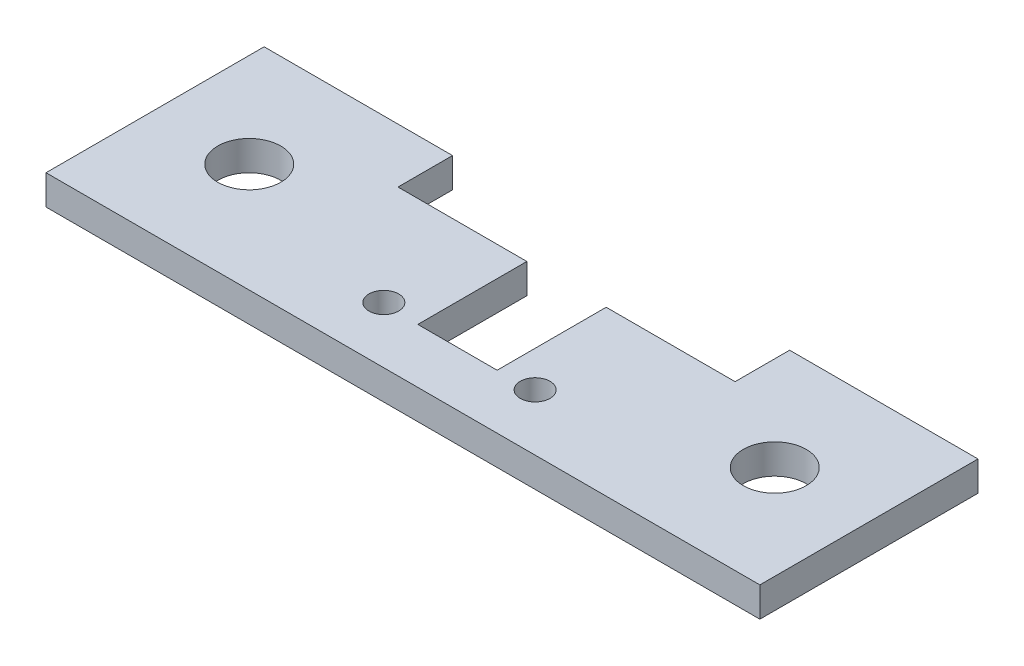
from build123d import *

# Parameters (mm, degrees)
SKETCH1_R           = 1.5
SKETCH1_R_2         = 3.175
BOSS_EXTRUDE1_DEPTH = 3


with BuildPart() as part:
    # Sketch1 → Boss-Extrude1 (new body)
    with BuildSketch(Plane(origin=(0, 0, 0), x_dir=(1, 0, 0), z_dir=(0, 1, 0))):
        Polygon((13, 0), (0, 0), (0, -11), (-8, -11), (-8, 0), (-21, 0), (-21, 5.5), (-40, 5.5), (-40, -16.5), (32, -16.5), (32, 5.5), (13, 5.5), align=None)
        with Locations((-11.63, -10.8)):
            Circle(SKETCH1_R, mode=Mode.SUBTRACT)
        with Locations((3.63, -10.8)):
            Circle(SKETCH1_R, mode=Mode.SUBTRACT)
        with Locations((22.5, -5.5)):
            Circle(SKETCH1_R_2, mode=Mode.SUBTRACT)
        with Locations((-30.5, -5.5)):
            Circle(SKETCH1_R_2, mode=Mode.SUBTRACT)
    extrude(amount=BOSS_EXTRUDE1_DEPTH)


solid = part.part
